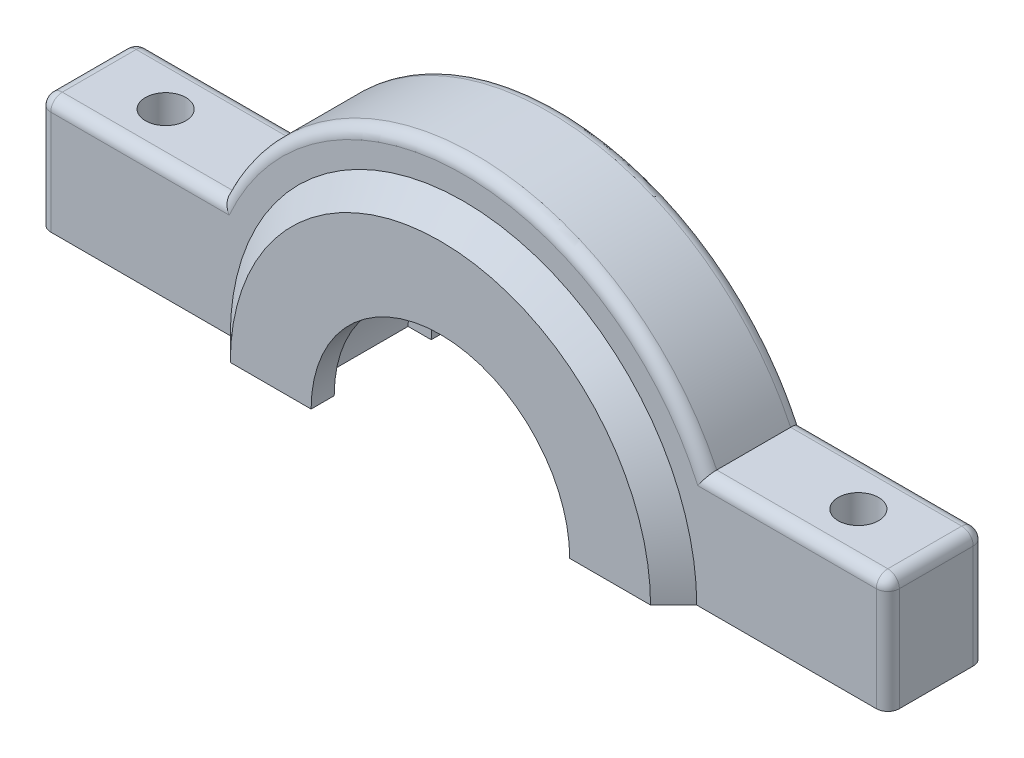
from build123d import *

# Parameters (mm, degrees)
BOSS_EXTRUDE1_DEPTH = 4.2
BOSS_EXTRUDE2_DEPTH = 2
CHAMFER1_SIZE       = 2
SKETCH3_R           = 1.75
CUT_EXTRUDE1_DEPTH  = 40.537861601
FILLET1_R           = 1


with BuildPart() as part:
    # Sketch1 → Boss-Extrude1 (new, symmetric)
    with BuildSketch(Plane.XY):
        with BuildLine():
            Line((36.75, 0), (13.2, 0))
            ThreePointArc((13.2, 0), (0, 13.2), (-13.2, 0))
            Line((-13.2, 0), (-36.75, 0))
            Line((-36.75, 0), (-36.75, 10))
            Line((-36.75, 10), (-20.934182573, 10))
            ThreePointArc((-20.934182573, 10), (0, 23.2), (20.934182573, 10))
            Line((20.934182573, 10), (36.75, 10))
            Line((36.75, 10), (36.75, 0))
        make_face()
    extrude(amount=BOSS_EXTRUDE1_DEPTH, both=True)

    # Sketch2 → Boss-Extrude2 (add)
    with BuildSketch(Plane.XY.offset(4.2)):
        with BuildLine():
            Line((-18.2, 0), (-11.2, 0))
            ThreePointArc((-11.2, 0), (0, 11.2), (11.2, 0))
            Line((11.2, 0), (18.2, 0))
            ThreePointArc((18.2, 0), (0, 18.2), (-18.2, 0))
        make_face()
    boss_extrude2 = extrude(amount=BOSS_EXTRUDE2_DEPTH)

    # Mirror1: Boss-Extrude2 across plane
    add(boss_extrude2.mirror(Plane.XY))

    # Chamfer1
    chamfer1_edges = [part.edges().sort_by_distance(p)[0] for p in [
        (0, 18.2, -4.2),
        (0, 18.2, 4.2),
    ]]
    chamfer(chamfer1_edges, length=CHAMFER1_SIZE - 0.0001)  # a hair under: the kernel refuses the full size

    # Sketch3 → Cut-Extrude1 (cut, through all)
    with BuildSketch(Plane(origin=(0, 10, 0), x_dir=(1, 0, 0), z_dir=(0, 1, 0))):
        with Locations(Location((-30, 0, 0), (0, 0, 270))):
            Circle(SKETCH3_R)
        with Locations(Location((30, 0, 0), (0, 0, 270))):
            Circle(SKETCH3_R)
    extrude(amount=-CUT_EXTRUDE1_DEPTH, mode=Mode.SUBTRACT)

    # Fillet1
    fillet1_edges = [part.edges().sort_by_distance(p)[0] for p in [
        (36.75, 5, -4.2),
        (-36.75, 10, 0),
        (36.75, 10, 0),
        (36.75, 5, 4.2),
        (28.842091287, 10, 4.2),
        (0, 23.2, 4.2),
        (-28.842091287, 10, 4.2),
        (-36.75, 5, 4.2),
        (-36.75, 5, -4.2),
        (-28.842091287, 10, -4.2),
        (0, 23.2, -4.2),
        (28.842091287, 10, -4.2),
    ]]
    fillet(fillet1_edges, radius=FILLET1_R)


solid = part.part
